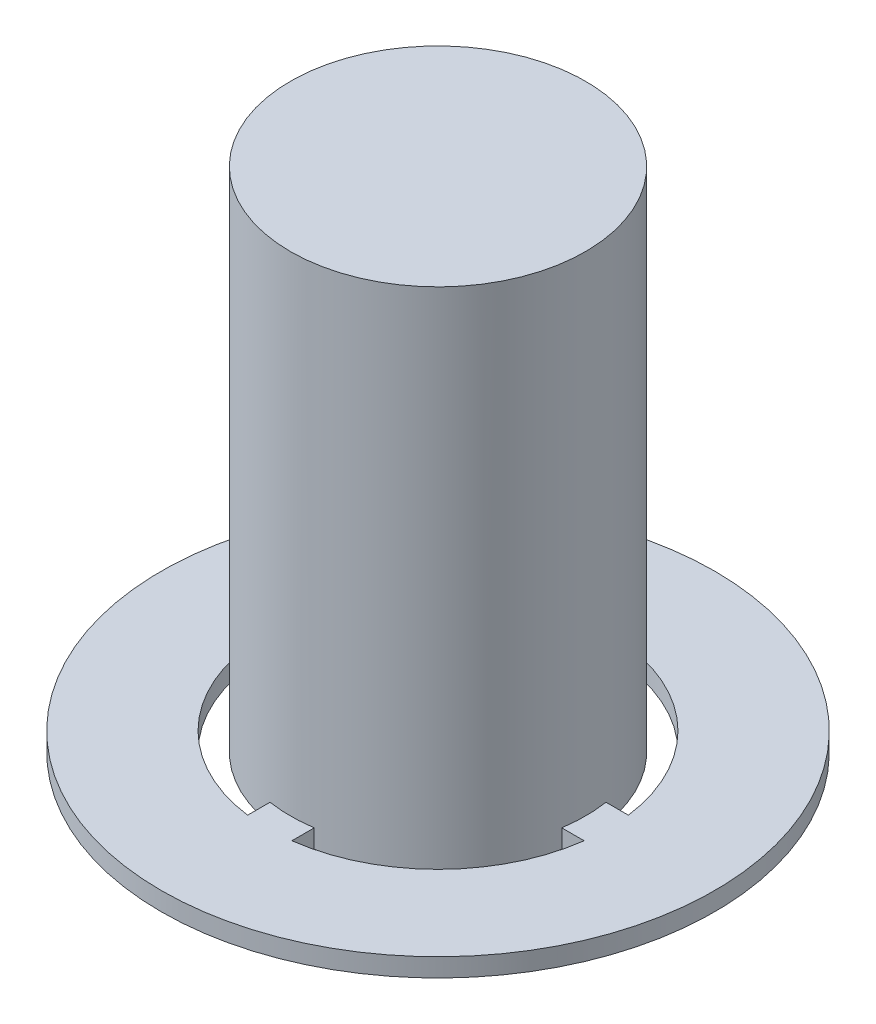
from build123d import *

# Parameters (mm, degrees)
SKETCH1_R           = 4
BOSS_EXTRUDE1_DEPTH = 13.75
SKETCH2_R           = 7.5
SKETCH2_R_2         = 4.6
BOSS_EXTRUDE2_DEPTH = 0.5
BOSS_EXTRUDE3_DEPTH = 0.5


with BuildPart() as part:
    # Sketch1 → Boss-Extrude1 (new body)
    with BuildSketch(Plane(origin=(0, 0, 0), x_dir=(1, 0, 0), z_dir=(0, 1, 0))):
        Circle(SKETCH1_R)
    extrude(amount=BOSS_EXTRUDE1_DEPTH)



with BuildPart() as body_2:
    # Sketch2 → Boss-Extrude2 (new body)
    with BuildSketch(Plane(origin=(0, 0, 0), x_dir=(-1, 0, 0), z_dir=(0, -1, 0))):
        Circle(SKETCH2_R)
        Circle(SKETCH2_R_2, mode=Mode.SUBTRACT)
    extrude(amount=-BOSS_EXTRUDE2_DEPTH)


with BuildPart() as part_1:
    add(part.part)

    add(body_2.part)  # Boss-Extrude3 merges body 2
    # Sketch3 → Boss-Extrude3 (add)
    with BuildSketch(Plane(origin=(0, 0, 0), x_dir=(-1, 0, 0), z_dir=(0, -1, 0))):
        Polygon((6, -0.6), (6, 0.6), (0.6, 0.6), (0.6, 6), (-0.6, 6), (-0.6, 0.6), (-6, 0.6), (-6, -0.6), (-0.6, -0.6), (-0.6, -6), (0.6, -6), (0.6, -0.6), align=None)
    extrude(amount=-BOSS_EXTRUDE3_DEPTH)


solid = part_1.part
